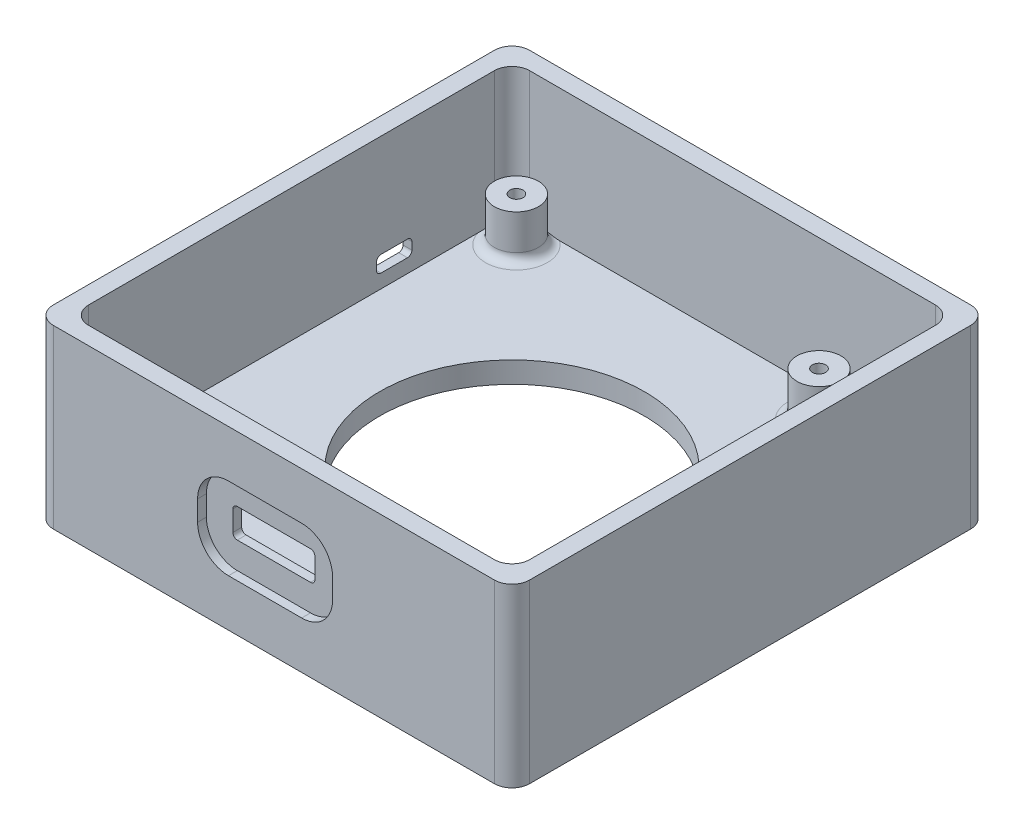
from build123d import *

# Parameters (mm, degrees)
SKETCH_1_W             = 54
SKETCH_1_H             = 54
EXTRUDE_1_DEPTH        = 20
SKETCH_2_W             = 50
SKETCH_2_H             = 50
CUT_EXTRUDE_1_DEPTH    = 15
SKETCH_3_R             = 2.5
SKETCH_3_R_2           = 0.75
EXTRUDE_2_DEPTH        = 5
FILLET_1_R             = 1
FILLET_1_OF_MIRROR_2_R = 1
SKETCH_4_R             = 21.9
CUT_EXTRUDE_2_DEPTH    = 1
SKETCH_6_R             = 18.5
CUT_EXTRUDE_4_DEPTH    = 1.6
SKETCH_8_R             = 15
CUT_EXTRUDE_5_DEPTH    = 5
SKETCH_10_W            = 23.151685838
SKETCH_10_H            = 17.85
CUT_EXTRUDE_6_DEPTH    = 10
CUT_EXTRUDE_8_DEPTH    = 0.5
CUT_EXTRUDE_9_DEPTH    = 10
CUT_EXTRUDE_10_DEPTH   = 0.5
CUT_EXTRUDE_11_DEPTH   = 10
CUT_EXTRUDE_12_DEPTH   = 0.5
CUT_EXTRUDE_13_DEPTH   = 0.5
FILLET_5_R             = 2


with BuildPart() as part:
    # 草图1 → 凸台-拉伸1 (new body)
    with BuildSketch(Plane(origin=(0, 0, 0), x_dir=(1, 0, 0), z_dir=(0, 1, 0))):
        Rectangle(SKETCH_1_W, SKETCH_1_H)
    extrude(amount=EXTRUDE_1_DEPTH)

    # 草图2 → 切除-拉伸1 (cut)
    with BuildSketch(Plane(origin=(0, 20, 0), x_dir=(1, 0, 0), z_dir=(0, 1, 0))):
        Rectangle(SKETCH_2_W, SKETCH_2_H)
    extrude(amount=-CUT_EXTRUDE_1_DEPTH, mode=Mode.SUBTRACT)

    # 草图3 → 凸台-拉伸2 (add)
    # profile 1 of 2: a face of its own
    with BuildSketch(Plane(origin=(0, 5, 0), x_dir=(1, 0, 0), z_dir=(0, 1, 0))):
        with Locations(Location((-21.65, 22.15, 0), (0, 0, 270))):
            Circle(SKETCH_3_R)
        with Locations(Location((-21.65, 22.15, 0), (0, 0, 270))):
            Circle(SKETCH_3_R_2, mode=Mode.SUBTRACT)
    # profile 2 of 2: a face of its own
    with BuildSketch(Plane(origin=(0, 5, 0), x_dir=(1, 0, 0), z_dir=(0, 1, 0))):
        with Locations(Location((-21.65, -22.15, 0), (0, 0, 270))):
            Circle(SKETCH_3_R)
        with Locations(Location((-21.65, -22.15, 0), (0, 0, 270))):
            Circle(SKETCH_3_R_2, mode=Mode.SUBTRACT)
    extrude_2 = extrude(amount=EXTRUDE_2_DEPTH)

    # 圆角1
    # the kernel refuses this fillet: 1 mm, written as the material it adds along each edge
    with BuildSketch(Plane(origin=(-21.65, 5, -22.15), x_dir=(0, 0, 1), z_dir=(-1, 0, 0))) as fillet_1_piece_1:
        with BuildLine():
            CenterArc((2.5 + FILLET_1_R, FILLET_1_R), FILLET_1_R, 180, 90)
            Line((2.5, FILLET_1_R), (2.5, 0))
            Line((2.5, 0), (2.5 + FILLET_1_R, 0))
        make_face()
    revolve(axis=Axis((-21.65, 5, -22.15), (0, 1, 0)))
    with BuildSketch(Plane(origin=(-21.65, 5, 22.15), x_dir=(0, 0, 1), z_dir=(-1, 0, 0))) as fillet_1_piece_2:
        with BuildLine():
            CenterArc((2.5 + FILLET_1_R, FILLET_1_R), FILLET_1_R, 180, 90)
            Line((2.5, FILLET_1_R), (2.5, 0))
            Line((2.5, 0), (2.5 + FILLET_1_R, 0))
        make_face()
    revolve(axis=Axis((-21.65, 5, 22.15), (0, 1, 0)))

    # 镜向2: 凸台-拉伸2 across plane
    add(extrude_2.mirror(Plane(origin=(-4.5, 0, 0), x_dir=(0, 0, 1), z_dir=(1, 0, 0))))

    # 圆角1 of 镜向2
    # the kernel refuses this fillet: 1 mm, written as the material it adds along each edge
    with BuildSketch(Plane(origin=(12.65, 5, -22.15), x_dir=(0, 0, 1), z_dir=(1, 0, 0))) as fillet_1_of_mirror_2_piece_1:
        with BuildLine():
            CenterArc((2.5 + FILLET_1_OF_MIRROR_2_R, -FILLET_1_OF_MIRROR_2_R), FILLET_1_OF_MIRROR_2_R, 90, 90)
            Line((2.5, -FILLET_1_OF_MIRROR_2_R), (2.5, 0))
            Line((2.5, 0), (2.5 + FILLET_1_OF_MIRROR_2_R, 0))
        make_face()
    revolve(axis=Axis((12.65, 5, -22.15), (0, -1, 0)))
    with BuildSketch(Plane(origin=(12.65, 5, 22.15), x_dir=(0, 0, 1), z_dir=(1, 0, 0))) as fillet_1_of_mirror_2_piece_2:
        with BuildLine():
            CenterArc((2.5 + FILLET_1_OF_MIRROR_2_R, -FILLET_1_OF_MIRROR_2_R), FILLET_1_OF_MIRROR_2_R, 90, 90)
            Line((2.5, -FILLET_1_OF_MIRROR_2_R), (2.5, 0))
            Line((2.5, 0), (2.5 + FILLET_1_OF_MIRROR_2_R, 0))
        make_face()
    revolve(axis=Axis((12.65, 5, 22.15), (0, -1, 0)))

    # 草图4 → 切除-拉伸2 (cut)
    with BuildSketch(Plane(origin=(0, 0, 0), x_dir=(-1, 0, 0), z_dir=(0, -1, 0))):
        with Locations(Location((0, 0, 0), (0, 0, 90))):
            Circle(SKETCH_4_R)
    extrude(amount=-CUT_EXTRUDE_2_DEPTH, mode=Mode.SUBTRACT)

    # 草图6 → 切除-拉伸4 (cut)
    with BuildSketch(Plane.XZ.offset(-1)):
        with Locations(Location((0, 0, 0), (0, 0, 270))):
            Circle(SKETCH_6_R)
    extrude(amount=-CUT_EXTRUDE_4_DEPTH, mode=Mode.SUBTRACT)

    # 草图8 → 切除-拉伸5 (cut)
    with BuildSketch(Plane.XZ.offset(-2.6)):
        with Locations(Location((0, 0, 0), (0, 0, 270))):
            Circle(SKETCH_8_R)
    extrude(amount=-CUT_EXTRUDE_5_DEPTH, mode=Mode.SUBTRACT)

    # 草图10 → 切除-拉伸6 (cut)
    with BuildSketch(Plane.XZ):
        with BuildLine():
            Line((19.998859342, 8.925), (19.998859342, -8.925))
            ThreePointArc((19.998859342, -8.925), (21.419442332, -4.562618787), (21.9, 0))
            ThreePointArc((21.9, 0), (21.419442332, 4.562618787), (19.998859342, 8.925))
        make_face()
        with Locations((8.423016423, 0)):
            Rectangle(SKETCH_10_W, SKETCH_10_H)
    extrude(amount=-CUT_EXTRUDE_6_DEPTH, mode=Mode.SUBTRACT)

    # 草图11 → 切除-拉伸8 (cut)
    with BuildSketch(Plane.XY.offset(27)):
        with BuildLine():
            Line((-5.14, 14.65), (3.16, 14.65))
            ThreePointArc((3.16, 14.65), (5.634873734, 13.624873734), (6.66, 11.15))
            Line((6.66, 11.15), (6.66, 8.85))
            ThreePointArc((6.66, 8.85), (5.634873734, 6.375126266), (3.16, 5.35))
            Line((3.16, 5.35), (-5.14, 5.35))
            ThreePointArc((-5.14, 5.35), (-7.614873734, 6.375126266), (-8.64, 8.85))
            Line((-8.64, 8.85), (-8.64, 11.15))
            ThreePointArc((-8.64, 11.15), (-7.614873734, 13.624873734), (-5.14, 14.65))
        make_face()
        with BuildLine():
            Line((-5.14, 11.65), (3.16, 11.65))
            ThreePointArc((3.16, 11.65), (3.513553391, 11.503553391), (3.66, 11.15))
            Line((3.66, 11.15), (3.66, 8.85))
            ThreePointArc((3.66, 8.85), (3.513553391, 8.496446609), (3.16, 8.35))
            Line((3.16, 8.35), (-5.14, 8.35))
            ThreePointArc((-5.14, 8.35), (-5.493553391, 8.496446609), (-5.64, 8.85))
            Line((-5.64, 8.85), (-5.64, 11.15))
            ThreePointArc((-5.64, 11.15), (-5.493553391, 11.503553391), (-5.14, 11.65))
        make_face(mode=Mode.SUBTRACT)
    extrude(amount=-CUT_EXTRUDE_8_DEPTH, mode=Mode.SUBTRACT)

    # 草图13 → 切除-拉伸9 (cut)
    with BuildSketch(Plane.XY.offset(27)):
        with BuildLine():
            ThreePointArc((3.16, 8.35), (3.513553391, 8.496446609), (3.66, 8.85))
            Line((3.66, 8.85), (3.66, 11.15))
            ThreePointArc((3.66, 11.15), (3.513553391, 11.503553391), (3.16, 11.65))
            Line((3.16, 11.65), (-5.14, 11.65))
            ThreePointArc((-5.14, 11.65), (-5.493553391, 11.503553391), (-5.64, 11.15))
            Line((-5.64, 11.15), (-5.64, 8.85))
            ThreePointArc((-5.64, 8.85), (-5.493553391, 8.496446609), (-5.14, 8.35))
            Line((-5.14, 8.35), (3.16, 8.35))
        make_face()
    extrude(amount=-CUT_EXTRUDE_9_DEPTH, mode=Mode.SUBTRACT)

    # 草图14 → 切除-拉伸10 (cut)
    with BuildSketch(Plane.ZY.offset(27)):
        with BuildLine():
            Line((-13.15, 10.387816511), (-10.15, 10.387816511))
            ThreePointArc((-10.15, 10.387816511), (-8.382233047, 9.655583464), (-7.65, 7.887816511))
            Line((-7.65, 7.887816511), (-7.65, 7.057816511))
            ThreePointArc((-7.65, 7.057816511), (-8.382233047, 5.290049558), (-10.15, 4.557816511))
            Line((-10.15, 4.557816511), (-13.15, 4.557816511))
            ThreePointArc((-13.15, 4.557816511), (-14.917766953, 5.290049558), (-15.65, 7.057816511))
            Line((-15.65, 7.057816511), (-15.65, 7.887816511))
            ThreePointArc((-15.65, 7.887816511), (-14.917766953, 9.655583464), (-13.15, 10.387816511))
        make_face()
        with BuildLine():
            Line((-10.15, 6.557816511), (-13.15, 6.557816511))
            ThreePointArc((-13.15, 6.557816511), (-13.503553391, 6.704263121), (-13.65, 7.057816511))
            Line((-13.65, 7.057816511), (-13.65, 7.887816511))
            ThreePointArc((-13.65, 7.887816511), (-13.503553391, 8.241369902), (-13.15, 8.387816511))
            Line((-13.15, 8.387816511), (-10.15, 8.387816511))
            ThreePointArc((-10.15, 8.387816511), (-9.796446609, 8.241369902), (-9.65, 7.887816511))
            Line((-9.65, 7.887816511), (-9.65, 7.057816511))
            ThreePointArc((-9.65, 7.057816511), (-9.796446609, 6.704263121), (-10.15, 6.557816511))
        make_face(mode=Mode.SUBTRACT)
    extrude(amount=-CUT_EXTRUDE_10_DEPTH, mode=Mode.SUBTRACT)

    # 草图15 → 切除-拉伸11 (cut)
    with BuildSketch(Plane.ZY.offset(27)):
        with BuildLine():
            Line((-9.65, 7.057816511), (-9.65, 7.887816511))
            ThreePointArc((-9.65, 7.887816511), (-9.796446609, 8.241369902), (-10.15, 8.387816511))
            Line((-10.15, 8.387816511), (-13.15, 8.387816511))
            ThreePointArc((-13.15, 8.387816511), (-13.503553391, 8.241369902), (-13.65, 7.887816511))
            Line((-13.65, 7.887816511), (-13.65, 7.057816511))
            ThreePointArc((-13.65, 7.057816511), (-13.503553391, 6.704263121), (-13.15, 6.557816511))
            Line((-13.15, 6.557816511), (-10.15, 6.557816511))
            ThreePointArc((-10.15, 6.557816511), (-9.796446609, 6.704263121), (-9.65, 7.057816511))
        make_face()
    extrude(amount=-CUT_EXTRUDE_11_DEPTH, mode=Mode.SUBTRACT)

    # 草图17 → 切除-拉伸12 (cut)
    with BuildSketch(Plane.XY.offset(26.5)):
        with BuildLine():
            Line((3.16, 14.65), (-5.14, 14.65))
            ThreePointArc((-5.14, 14.65), (-7.614873734, 13.624873734), (-8.64, 11.15))
            Line((-8.64, 11.15), (-8.64, 8.85))
            ThreePointArc((-8.64, 8.85), (-7.614873734, 6.375126266), (-5.14, 5.35))
            Line((-5.14, 5.35), (3.16, 5.35))
            ThreePointArc((3.16, 5.35), (5.634873734, 6.375126266), (6.66, 8.85))
            Line((6.66, 8.85), (6.66, 11.15))
            ThreePointArc((6.66, 11.15), (5.634873734, 13.624873734), (3.16, 14.65))
        make_face()
    extrude(amount=-CUT_EXTRUDE_12_DEPTH, mode=Mode.SUBTRACT)

    # 草图18 → 切除-拉伸13 (cut)
    with BuildSketch(Plane.ZY.offset(26.5)):
        with BuildLine():
            Line((-15.65, 7.887816511), (-15.65, 7.057816511))
            ThreePointArc((-15.65, 7.057816511), (-14.917766953, 5.290049558), (-13.15, 4.557816511))
            Line((-13.15, 4.557816511), (-10.15, 4.557816511))
            ThreePointArc((-10.15, 4.557816511), (-8.382233047, 5.290049558), (-7.65, 7.057816511))
            Line((-7.65, 7.057816511), (-7.65, 7.887816511))
            ThreePointArc((-7.65, 7.887816511), (-8.382233047, 9.655583464), (-10.15, 10.387816511))
            Line((-10.15, 10.387816511), (-13.15, 10.387816511))
            ThreePointArc((-13.15, 10.387816511), (-14.917766953, 9.655583464), (-15.65, 7.887816511))
        make_face()
    extrude(amount=-CUT_EXTRUDE_13_DEPTH, mode=Mode.SUBTRACT)

    # 圆角5
    # the kernel refuses this fillet: 2 mm, written as the material it adds along each edge
    with BuildSketch(Plane(origin=(-25, 20, 25), x_dir=(0, 0, -1), z_dir=(0, -1, 0))) as fillet_5_piece_1:
        with BuildLine():
            CenterArc((FILLET_5_R, FILLET_5_R), FILLET_5_R, 180, 90)
            Line((0, FILLET_5_R), (0, 0))
            Line((0, 0), (FILLET_5_R, 0))
        make_face()
    extrude(amount=20)
    with BuildSketch(Plane(origin=(25, 20, 25), x_dir=(0, 0, -1), z_dir=(0, -1, 0)), Plane(origin=(25, 20, -25), x_dir=(-1, 0, 0), z_dir=(0, -1, 0)), Plane(origin=(-25, 20, -25), x_dir=(0, 0, 1), z_dir=(0, -1, 0))) as fillet_5_piece_2:
        with BuildLine():
            CenterArc((FILLET_5_R, -FILLET_5_R), FILLET_5_R, 90, 90)
            Line((0, -FILLET_5_R), (0, 0))
            Line((0, 0), (FILLET_5_R, 0))
        make_face()
    extrude(amount=20)
    # the kernel refuses this fillet: 2 mm, written as the material it takes off along each edge
    with BuildSketch(Plane(origin=(-27, -5, 27), x_dir=(0, 0, -1), z_dir=(0, 1, 0)), Plane(origin=(-27, -5, -27), x_dir=(1, 0, 0), z_dir=(0, 1, 0))) as fillet_5_2_piece_1:
        with BuildLine():
            CenterArc((FILLET_5_R, -FILLET_5_R), FILLET_5_R, 90, 90)
            Line((0, -FILLET_5_R), (0, 0))
            Line((0, 0), (FILLET_5_R, 0))
        make_face()
    extrude(amount=30, mode=Mode.SUBTRACT)
    with BuildSketch(Plane(origin=(27, -5, 27), x_dir=(0, 0, -1), z_dir=(0, 1, 0)), Plane(origin=(27, -5, -27), x_dir=(-1, 0, 0), z_dir=(0, 1, 0))) as fillet_5_2_piece_2:
        with BuildLine():
            CenterArc((FILLET_5_R, FILLET_5_R), FILLET_5_R, 180, 90)
            Line((0, FILLET_5_R), (0, 0))
            Line((0, 0), (FILLET_5_R, 0))
        make_face()
    extrude(amount=30, mode=Mode.SUBTRACT)


solid = part.part
